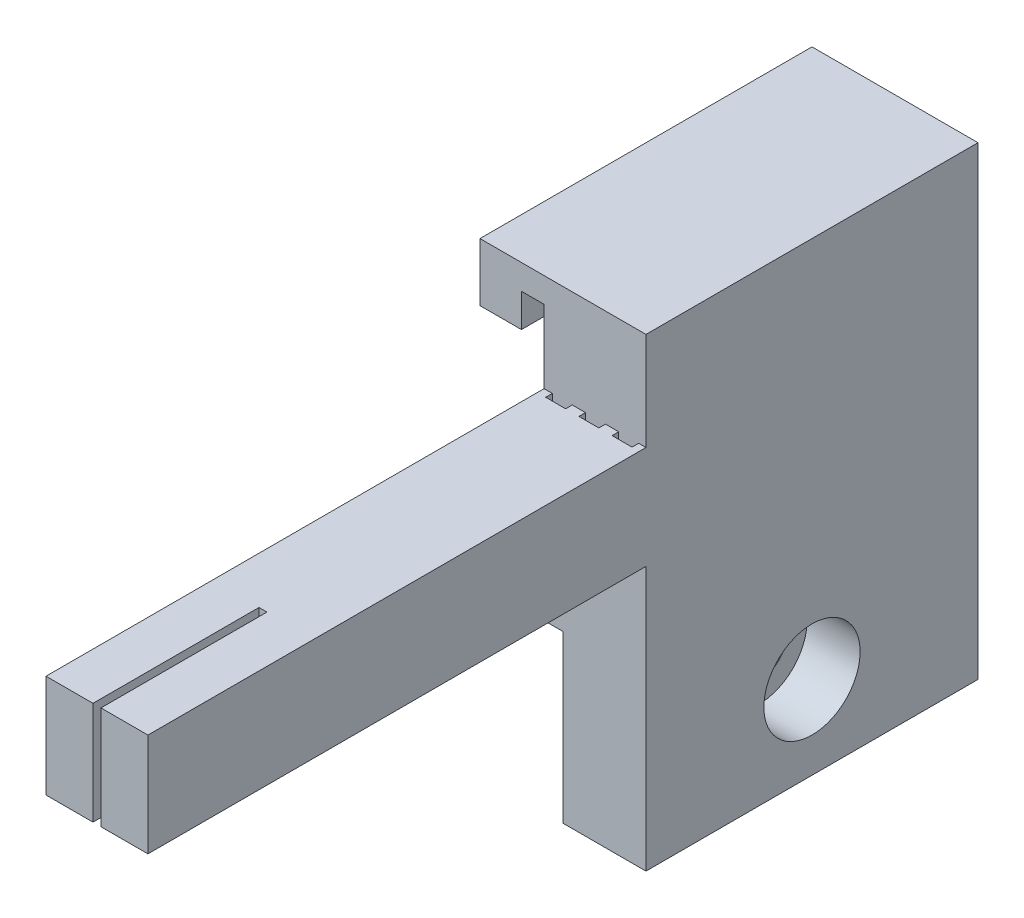
from build123d import *

# Parameters (mm, degrees)
BOSS_EXTRUDE1_DEPTH               = 12.7
CUT_EXTRUDE1_DEPTH                = 27.910817528
CUT_EXTRUDE1_DEPTH_BACK           = 27.910817528
SCREWHOLE_R                       = 2.159
CUT_EXTRUDE2_START                = -4.064
SKETCH3_R                         = 3.683
SKETCH3_R_2                       = 2.159
CUT_EXTRUDE2_DEPTH                = 4.064
CUT_EXTRUDE3_DEPTH                = 35.757187746
CUT_EXTRUDE3_DEPTH_BACK           = 35.757187746
SHITTY_LITTLE_HALL_EFFECT_PLANK_W = 7.7978
SHITTY_LITTLE_HALL_EFFECT_PLANK_H = 7.874
BOSS_EXTRUDE2_DEPTH               = 38.1
CUT_EXTRUDE4_DEPTH                = 59.384235792
CUT_EXTRUDE4_DEPTH_BACK           = 59.384235792
SKETCH6_W                         = 1.524
SKETCH6_H                         = 0.508
SKETCH6_W_2                       = 0.6096
SKETCH6_H_2                       = 12.7


with BuildPart() as part:
    # Profile → Boss-Extrude1 (new, symmetric)
    with BuildSketch(Plane.XY):
        Polygon((6.35, 22.86), (-6.35, 22.86), (-6.35, 0), (0, 0), (0, -12.7), (6.35, -12.7), align=None)
    extrude(amount=BOSS_EXTRUDE1_DEPTH, both=True)

    # ScrewHole → Cut-Extrude1 (cut, two sides: drawn at the far end of the back side and taken through both)
    with BuildSketch(Plane.ZY.offset(-CUT_EXTRUDE1_DEPTH_BACK)):
        with Locations((0, -6.35)):
            Circle(SCREWHOLE_R)
    extrude(amount=CUT_EXTRUDE1_DEPTH + CUT_EXTRUDE1_DEPTH_BACK, mode=Mode.SUBTRACT)

    # Sketch3 → Cut-Extrude2 (cut)
    with BuildSketch(Plane(origin=(6.35, 0, 0), x_dir=(0, 0, -1), z_dir=(1, 0, 0)).offset(CUT_EXTRUDE2_START)):
        with Locations((0, -6.35)):
            Circle(SKETCH3_R)
        with Locations((0, -6.35)):
            Circle(SKETCH3_R_2, mode=Mode.SUBTRACT)
    extrude(amount=CUT_EXTRUDE2_DEPTH, mode=Mode.SUBTRACT)

    # Sketch4 → Cut-Extrude3 (cut, two sides: drawn at the far end of the back side and taken through both)
    with BuildSketch(Plane.XY.offset(12.7).offset(-CUT_EXTRUDE3_DEPTH_BACK)):
        Polygon((-1.4478, 1.905), (-1.4478, 20.955), (-3.175, 20.955), (-3.175, 18.415), (-6.35, 18.415), (-6.35, 4.445), (-3.175, 4.445), (-3.175, 1.905), align=None)
    extrude(amount=CUT_EXTRUDE3_DEPTH + CUT_EXTRUDE3_DEPTH_BACK, mode=Mode.SUBTRACT)

    # shitty little hall effect plank → Boss-Extrude2 (add)
    with BuildSketch(Plane.XY.offset(12.7)):
        with Locations((2.4511, 11.43)):
            Rectangle(SHITTY_LITTLE_HALL_EFFECT_PLANK_W, SHITTY_LITTLE_HALL_EFFECT_PLANK_H)
    extrude(amount=BOSS_EXTRUDE2_DEPTH)

    # Sketch6 → Cut-Extrude4 (cut, two sides: drawn at the far end of the back side and taken through both)
    with BuildSketch(Plane(origin=(0, 15.367, 0), x_dir=(1, 0, 0), z_dir=(0, 1, 0)).offset(-CUT_EXTRUDE4_DEPTH_BACK)):
        with Locations((-0.0508, -12.954)):
            Rectangle(SKETCH6_W, SKETCH6_H)
        with Locations((2.4892, -12.954)):
            Rectangle(SKETCH6_W, SKETCH6_H)
        with Locations((5.0292, -12.954)):
            Rectangle(SKETCH6_W, SKETCH6_H)
        with Locations((2.4511, -44.45)):
            Rectangle(SKETCH6_W_2, SKETCH6_H_2)
    extrude(amount=CUT_EXTRUDE4_DEPTH + CUT_EXTRUDE4_DEPTH_BACK, mode=Mode.SUBTRACT)


solid = part.part
